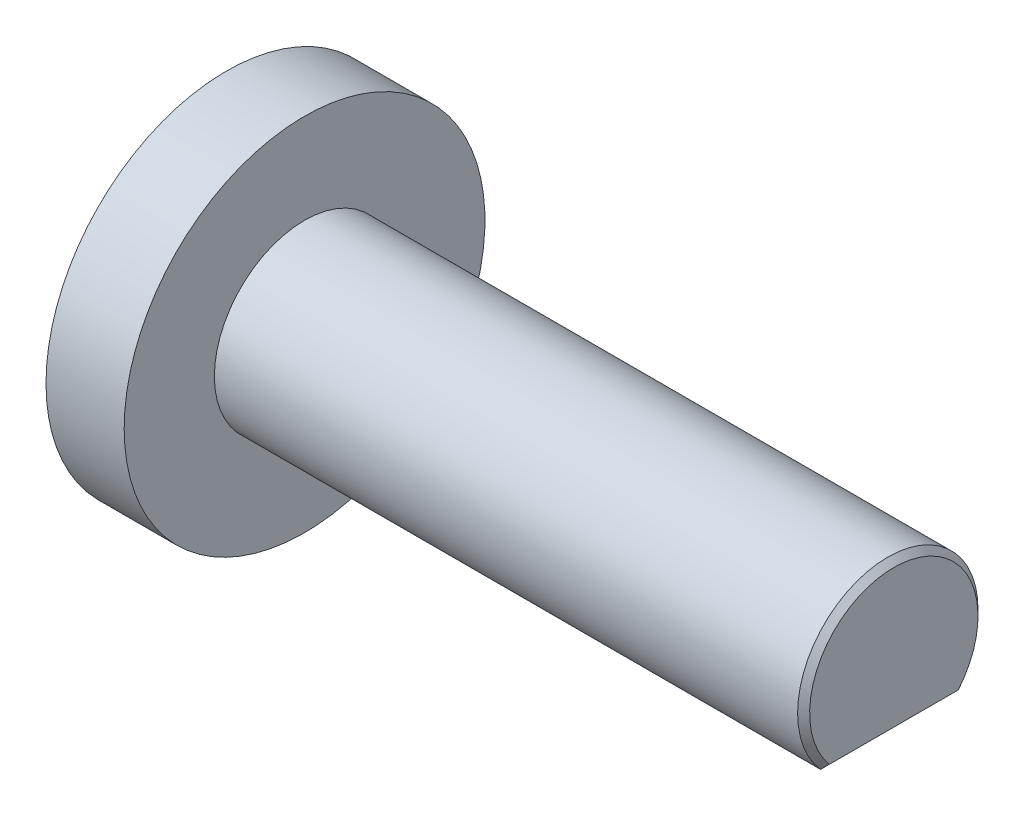
from build123d import *

# Parameters (mm, degrees)
SKIZZE2_W                       = 2.236067978
SKIZZE2_H                       = 0.5
SCHNITT_LINEAR_AUSTRAGEN1_DEPTH = 9
FASE1_SIZE                      = 0.1


with BuildPart() as part:
    # Skizze1 → Rotation1 (revolve)
    with BuildSketch(Plane.XY):
        Polygon((0, 0), (0, 3), (1.3, 3), (1.3, 1.5), (11.1, 1.5), (11.1, 0), align=None)
    revolve(axis=Axis((0, 0, 0), (1, 0, 0)))

    # Skizze2 → Schnitt-Linear austragen1 (cut)
    with BuildSketch(Plane(origin=(11.1, 0, 0), x_dir=(0, 0, -1), z_dir=(1, 0, 0))):
        with Locations((0, -1.25)):
            Rectangle(SKIZZE2_W, SKIZZE2_H)
    extrude(amount=-SCHNITT_LINEAR_AUSTRAGEN1_DEPTH, mode=Mode.SUBTRACT)

    # Fase1
    fase1_edges = [part.edges().sort_by_distance(p)[0] for p in [
        (11.1, 0.612372436, 1.369306394),
        (11.1, -1, 0),
    ]]
    chamfer(fase1_edges, length=FASE1_SIZE)


solid = part.part
